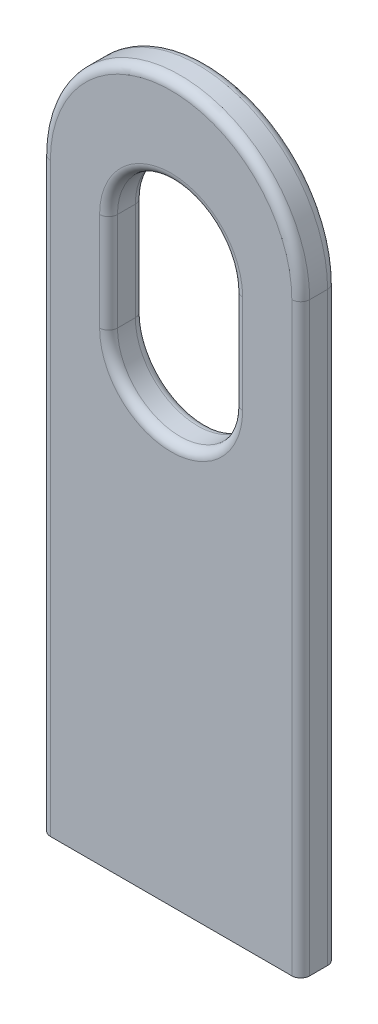
from build123d import *

# Parameters (mm, degrees)
SKETCH1_W      = 2.9
SKETCH1_H      = 8
SKETCH1_W_2    = 1.4
SKETCH1_H_2    = 2.5
EXTRUDE1_DEPTH = 0.2
FILLET4_RADIUS = 1.45
FILLET4_LENGTH = 0.4
FILLET5_R      = 0.7
FILLET6_R      = 0.7
FILLET3_R      = 0.1


with BuildPart() as part:
    # Sketch1 → Extrude1 (new, symmetric)
    with BuildSketch(Plane.XY):
        with Locations((0, 4)):
            Rectangle(SKETCH1_W, SKETCH1_H)
        with Locations((0, 5.75)):
            Rectangle(SKETCH1_W_2, SKETCH1_H_2, mode=Mode.SUBTRACT)
    extrude(amount=EXTRUDE1_DEPTH, both=True)

    # Fillet4: full round fillet: the end face becomes a half cylinder, R = half its width
    fillet4_face = Plane((0, 8, 0), x_dir=(0, 0, 1), z_dir=(0, 1, 0))  # on the end face: x along it, z out of the body
    fillet4_slab = fillet4_face.offset(-FILLET4_RADIUS / 2) * Box(FILLET4_LENGTH, 2 * FILLET4_RADIUS, FILLET4_RADIUS, mode=Mode.PRIVATE)  # the body's end, R deep
    fillet4_round = Plane((0, 6.55, 0), x_dir=(0, 1, 0), z_dir=(0, 0, 1)) * Cylinder(FILLET4_RADIUS, FILLET4_LENGTH, mode=Mode.PRIVATE)  # its axis R under the face
    add(fillet4_slab - fillet4_round, mode=Mode.SUBTRACT)

    # Fillet5
    fillet5_edges = [part.edges().sort_by_distance(p)[0] for p in [
        (-0.7, 7, 0),
        (0.7, 7, 0),
    ]]
    fillet(fillet5_edges, radius=FILLET5_R - 0.0001)  # a hair under: the kernel refuses the full size

    # Fillet6
    fillet6_edges = [part.edges().sort_by_distance(p)[0] for p in [
        (-0.7, 4.5, 0),
        (0.7, 4.5, 0),
    ]]
    fillet(fillet6_edges, radius=FILLET6_R - 0.0001)  # a hair under: the kernel refuses the full size

    # Fillet3
    fillet3_edges = [part.edges().sort_by_distance(p)[0] for p in [
        (1.45, 3.275, 0.2),
        (-1.45, 3.275, -0.2),
        (-1.45, 3.275, 0.2),
        (0, 8, -0.2),
        (0, 8, 0.2),
        (-0.7, 5.75, -0.2),
        (-0.7, 5.75, 0.2),
        (0, 7, -0.2),
        (0, 7, 0.2),
        (0.7, 5.75, 0.2),
        (0.7, 5.75, -0.2),
        (0, 4.5, 0.2),
        (0, 4.5, -0.2),
        (1.45, 3.275, -0.2),
    ]]
    fillet(fillet3_edges, radius=FILLET3_R)


solid = part.part
